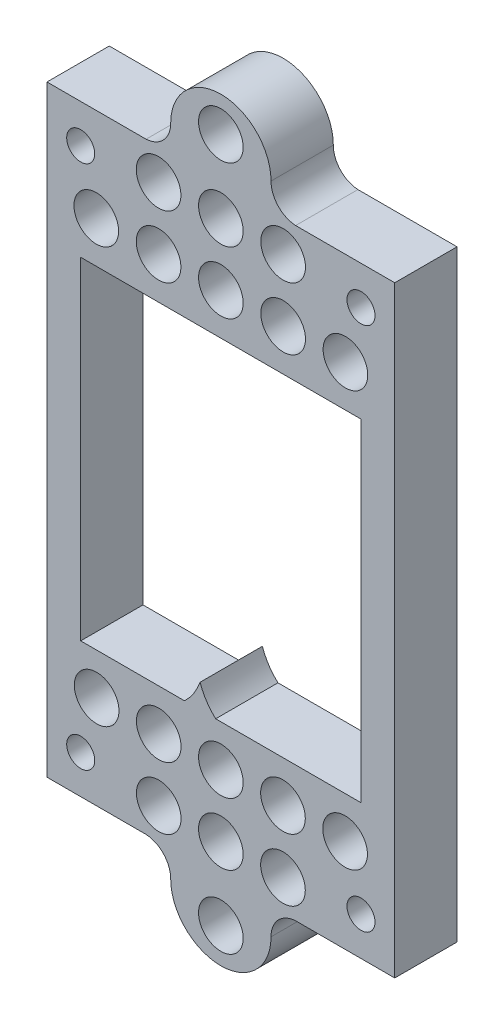
from build123d import *

# Parameters (mm, degrees)
SKETCH1_R           = 1.35
SKETCH1_R_2         = 2.15
BOSS_EXTRUDE1_DEPTH = 6
SKETCH2_R           = 2.15
CUT_EXTRUDE1_DEPTH  = 4.2


with BuildPart() as part:
    # Sketch1 → Boss-Extrude1 (new body)
    with BuildSketch(Plane.XY):
        with BuildLine():
            Line((-16.75, 29), (-7.202814531, 29))
            ThreePointArc((-7.202814531, 29), (-5.51284844, 29.788355297), (-4.832613897, 31.524664725))
            ThreePointArc((-4.832613897, 31.524664725), (0, 36.357278621), (4.832613897, 31.524664725))
            ThreePointArc((4.832613897, 31.524664725), (5.51284844, 29.788355297), (7.202814531, 29))
            Line((7.202814531, 29), (16.75, 29))
            Line((16.75, 29), (16.75, -29))
            Line((16.75, -29), (7.202814531, -29))
            ThreePointArc((7.202814531, -29), (5.51284844, -29.788355297), (4.832613897, -31.524664725))
            ThreePointArc((4.832613897, -31.524664725), (0, -36.357278621), (-4.832613897, -31.524664725))
            ThreePointArc((-4.832613897, -31.524664725), (-5.51284844, -29.788355297), (-7.202814531, -29))
            Line((-7.202814531, -29), (-16.75, -29))
            Line((-16.75, -29), (-16.75, 29))
        make_face()
        with Locations((-13.5, 25.3)):
            Circle(SKETCH1_R, mode=Mode.SUBTRACT)
        with Locations((13.5, -25.3)):
            Circle(SKETCH1_R, mode=Mode.SUBTRACT)
        with Locations((-13.5, -25.3)):
            Circle(SKETCH1_R, mode=Mode.SUBTRACT)
        with Locations((13.5, 25.3)):
            Circle(SKETCH1_R, mode=Mode.SUBTRACT)
        with Locations((0, 33)):
            Circle(SKETCH1_R_2, mode=Mode.SUBTRACT)
        with Locations((0, -33)):
            Circle(SKETCH1_R_2, mode=Mode.SUBTRACT)
        with BuildLine():
            Line((-13.5, 16), (13.5, 16))
            Line((13.5, 16), (13.5, -16))
            Line((13.5, -16), (-0.5, -16))
            ThreePointArc((-0.5, -16), (-1.396990669, -14.94586348), (-2, -13.7))
            ThreePointArc((-2, -13.7), (-2.615937149, -14.937432294), (-3.5, -16))
            Line((-3.5, -16), (-13.5, -16))
            Line((-13.5, -16), (-13.5, 16))
        make_face(mode=Mode.SUBTRACT)
    extrude(amount=BOSS_EXTRUDE1_DEPTH)

    # Sketch2 → Cut-Extrude1 (cut)
    with BuildSketch(Plane.XY.offset(6)):
        with Locations((-12, 20)):
            Circle(SKETCH2_R)
        with Locations((-6, 20)):
            Circle(SKETCH2_R)
        with Locations((0, 20)):
            Circle(SKETCH2_R)
        with Locations((6, 20)):
            Circle(SKETCH2_R)
        with Locations((12, 20)):
            Circle(SKETCH2_R)
        with Locations((-6, 26)):
            Circle(SKETCH2_R)
        with Locations((0, 26)):
            Circle(SKETCH2_R)
        with Locations((6, 26)):
            Circle(SKETCH2_R)
        with Locations((-11.967349369, -20)):
            Circle(SKETCH2_R)
        with Locations((-5.983674685, -20)):
            Circle(SKETCH2_R)
        with Locations((0, -20)):
            Circle(SKETCH2_R)
        with Locations((5.983674685, -20)):
            Circle(SKETCH2_R)
        with Locations((11.967349369, -20)):
            Circle(SKETCH2_R)
        with Locations((-5.983674685, -26)):
            Circle(SKETCH2_R)
        with Locations((0, -26)):
            Circle(SKETCH2_R)
        with Locations((5.983674685, -26)):
            Circle(SKETCH2_R)
    extrude(amount=-CUT_EXTRUDE1_DEPTH, mode=Mode.SUBTRACT)


solid = part.part
